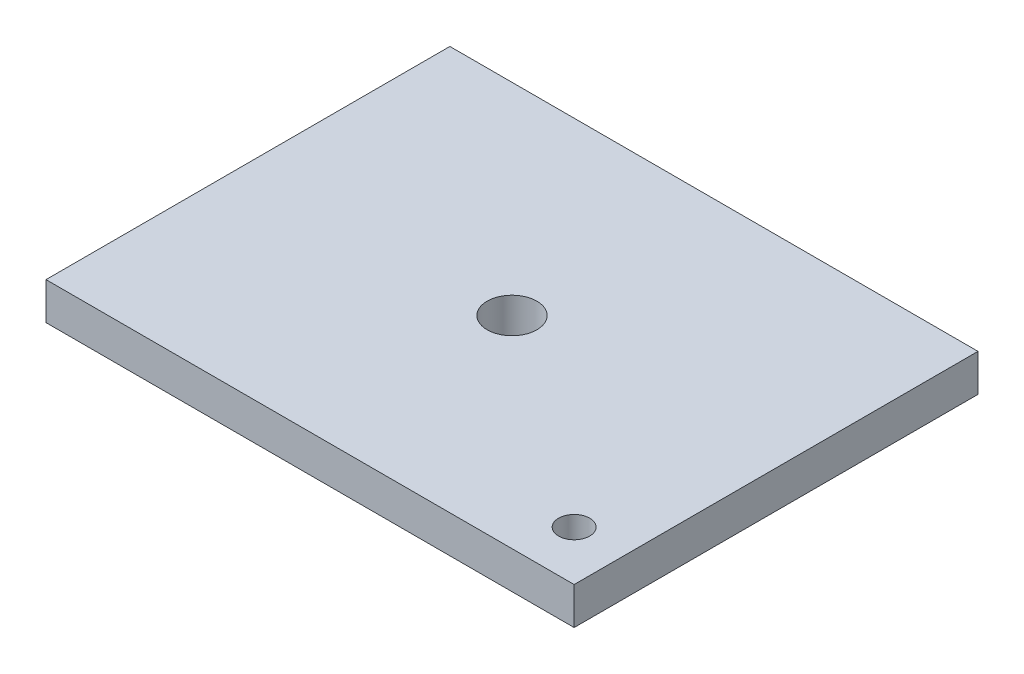
from build123d import *

# Parameters (mm, degrees)
SKETCH_1_W          = 85
SKETCH_1_H          = 65
SKETCH_1_R          = 4
EXTRUDE_1_DEPTH     = 6
SKETCH_2_R          = 2.5
CUT_EXTRUDE_1_DEPTH = 108.172757733


with BuildPart() as part:
    # Эскиз1 → Вытянуть1 (new body)
    with BuildSketch(Plane(origin=(0, 0, 0), x_dir=(1, 0, 0), z_dir=(0, 1, 0))):
        with Locations((42.5, -32.5)):
            Rectangle(SKETCH_1_W, SKETCH_1_H)
        with Locations((42.5, -32.5)):
            Circle(SKETCH_1_R, mode=Mode.SUBTRACT)
    extrude(amount=EXTRUDE_1_DEPTH)

    # Эскиз2 → Вырез-Вытянуть1 (cut, through all)
    with BuildSketch(Plane(origin=(0, 6, 0), x_dir=(1, 0, 0), z_dir=(0, 1, 0))):
        with Locations((77, -57)):
            Circle(SKETCH_2_R)
    extrude(amount=-CUT_EXTRUDE_1_DEPTH, mode=Mode.SUBTRACT)


solid = part.part
